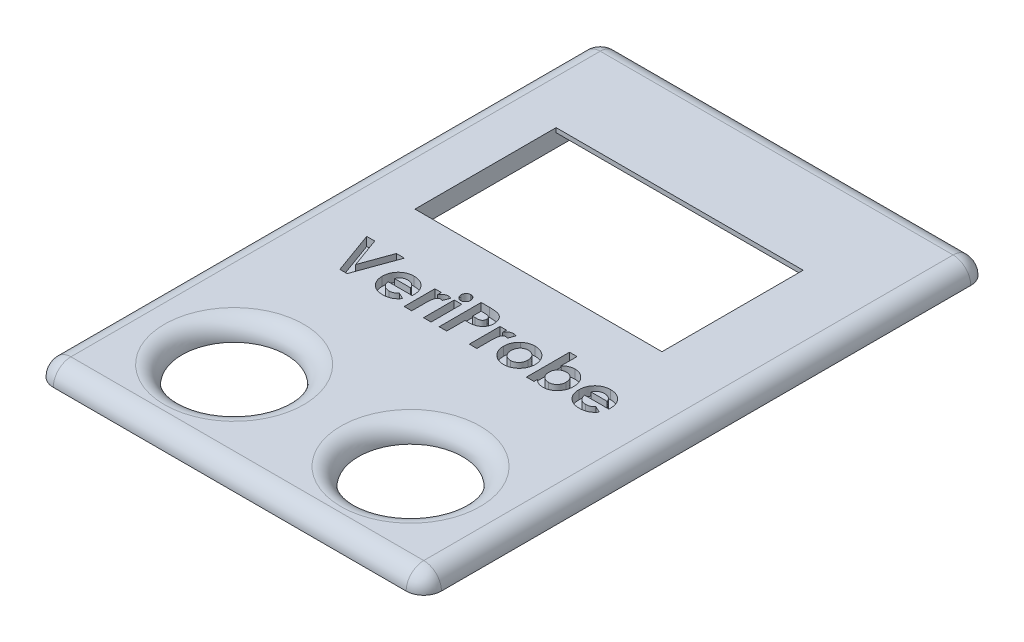
from build123d import *

# Parameters (mm, degrees)
SKETCH1_W           = 44
SKETCH1_H           = 64
BOSS_EXTRUDE1_DEPTH = 2
SKETCH2_W           = 28
SKETCH2_H           = 16
CUT_EXTRUDE1_DEPTH  = 10
SKETCH3_W           = 28
SKETCH3_H           = 7.538652277
CUT_EXTRUDE2_DEPTH  = 1.5
SKETCH4_R           = 5.9
CUT_EXTRUDE3_DEPTH  = 6.5
FILLET2_R           = 2
FILLET3_R           = 2
FILLET4_R           = 2
SKETCH5_W           = 0.854807692
SKETCH5_H           = 3.480288462
CUT_EXTRUDE4_DEPTH  = 1


with BuildPart() as part:
    # Sketch1 → Boss-Extrude1 (new body)
    with BuildSketch(Plane(origin=(0, 14, 0), x_dir=(1, 0, 0), z_dir=(0, 1, 0))):
        Rectangle(SKETCH1_W, SKETCH1_H)
    extrude(amount=BOSS_EXTRUDE1_DEPTH)

    # Sketch2 → Cut-Extrude1 (cut)
    with BuildSketch(Plane(origin=(0, 16, 0), x_dir=(1, 0, 0), z_dir=(0, 1, 0))):
        with Locations((-1, 12)):
            Rectangle(SKETCH2_W, SKETCH2_H)
    extrude(amount=-CUT_EXTRUDE1_DEPTH, mode=Mode.SUBTRACT)

    # Sketch3 → Cut-Extrude2 (cut)
    with BuildSketch(Plane.XZ.offset(-14)):
        with Locations((-1, -23.769326138)):
            Rectangle(SKETCH3_W, SKETCH3_H)
    extrude(amount=-CUT_EXTRUDE2_DEPTH, mode=Mode.SUBTRACT)

    # Sketch4 → Cut-Extrude3 (cut)
    with BuildSketch(Plane(origin=(0, 16, 0), x_dir=(1, 0, 0), z_dir=(0, 1, 0))):
        with Locations(Location((-10, -21.5, 0), (0, 0, 270))):
            Circle(SKETCH4_R)
        with Locations(Location((10, -21.5, 0), (0, 0, 270))):
            Circle(SKETCH4_R)
    extrude(amount=-CUT_EXTRUDE3_DEPTH, mode=Mode.SUBTRACT)

    # Fillet2
    fillet2_edges = [part.edges().sort_by_distance(p)[0] for p in [
        (-22, 15, -32),
        (22, 15, -32),
        (22, 15, 32),
        (-22, 15, 32),
    ]]
    fillet(fillet2_edges, radius=FILLET2_R)

    # Fillet3
    fillet3_edges = [part.edges().sort_by_distance(p)[0] for p in [
        (-21.414213562, 16, -31.414213562),
        (0, 16, -32),
        (21.414213562, 16, -31.414213562),
        (22, 16, 0),
        (21.414213562, 16, 31.414213562),
        (0, 16, 32),
        (-21.414213562, 16, 31.414213562),
        (-22, 16, 0),
    ]]
    fillet(fillet3_edges, radius=FILLET3_R - 0.0001)  # a hair under: the kernel refuses the full size

    # Fillet4
    fillet4_edges = [part.edges().sort_by_distance(p)[0] for p in [
        (-10, 16, 15.6),
        (10, 16, 15.6),
    ]]
    fillet(fillet4_edges, radius=FILLET4_R - 0.0001)  # a hair under: the kernel refuses the full size

    # Sketch5 → Cut-Extrude4 (cut)
    # profile 1 of 10: a face of its own
    with BuildSketch(Plane(origin=(0, 16, 0), x_dir=(1, 0, 0), z_dir=(0, 1, 0))):
        Polygon((-15.057266509, -1.411946768), (-14.144263204, -1.411946768), (-12.920247278, -4.794924532), (-11.693369273, -1.411946768), (-10.783228047, -1.411946768), (-12.510015908, -6.174446768), (-13.333340728, -6.174446768), align=None)
    # profile 2 of 10: a face of its own
    with BuildSketch(Plane(origin=(0, 16, 0), x_dir=(1, 0, 0), z_dir=(0, 1, 0))):
        with BuildLine():
            Line((-6.664695896, -4.64800446), (-9.40942997, -4.64800446))
            add(Edge.make_bspline(
                [(-9.40942997, -4.64800446), (-9.403833679, -4.679896713), (-9.392836526, -4.742567506), (-9.368955816, -4.833602271), (-9.338480448, -4.919391896), (-9.301957639, -5.000051063), (-9.260003163, -5.076006183), (-9.211066743, -5.146900999), (-9.155769092, -5.21267289), (-9.094429927, -5.273036006), (-9.028071661, -5.327122665), (-8.957016105, -5.374505998), (-8.881189937, -5.413357433), (-8.801462473, -5.446105161), (-8.717237966, -5.472044679), (-8.62839246, -5.489934671), (-8.535161469, -5.500502355), (-8.47164967, -5.502030849), (-8.439185079, -5.502812152)],
                knots=[0, 0, 0, 0, 1.091296461, 2.144483647, 3.168565212, 4.157007626, 5.126487748, 6.090021542, 7.05641414, 8.019231907, 8.98705074, 9.938580405, 10.892824166, 11.854447369, 12.841318655, 13.858982407, 14.905600794, 16, 16, 16, 16], degree=3))
            add(Edge.make_bspline(
                [(-8.439185079, -5.502812152), (-8.399998112, -5.501777578), (-8.322827436, -5.499740198), (-8.20977182, -5.48167166), (-8.100430571, -5.454379927), (-7.995838442, -5.413794829), (-7.894783898, -5.363273517), (-7.798930606, -5.300330179), (-7.706619422, -5.226804224), (-7.650298722, -5.170130446), (-7.621584418, -5.141236131)],
                knots=[0, 0, 0, 0, 1.021034703, 2.010718019, 2.977989445, 3.954245119, 4.929443971, 5.918328161, 6.938689359, 8, 8, 8, 8], degree=3))
            Line((-7.621584418, -5.141236131), (-6.906064586, -5.481823571))
            add(Edge.make_bspline(
                [(-6.906064586, -5.481823571), (-6.92859231, -5.512953428), (-6.973230167, -5.574636096), (-7.046099971, -5.66143954), (-7.122144252, -5.742430675), (-7.201419723, -5.81707681), (-7.284026925, -5.885165232), (-7.369736065, -5.947525382), (-7.459799747, -6.002482915), (-7.552417165, -6.052696643), (-7.649502891, -6.095744639), (-7.750788246, -6.13245445), (-7.85584423, -6.165639807), (-7.965997474, -6.190925231), (-8.080330731, -6.210940967), (-8.199117511, -6.22515479), (-8.322342156, -6.233933988), (-8.40609723, -6.234974752), (-8.448725343, -6.23550446)],
                knots=[0, 0, 0, 0, 1.028154879, 2.037251081, 3.030720504, 4.000128189, 4.949298328, 5.894184978, 6.834267904, 7.770992897, 8.712077017, 9.673380525, 10.653304757, 11.658697181, 12.695551717, 13.758623199, 14.859225354, 16, 16, 16, 16], degree=3))
            add(Edge.make_bspline(
                [(-8.448725343, -6.23550446), (-8.514307996, -6.234167427), (-8.642747841, -6.231548925), (-8.830614332, -6.207245479), (-9.009035393, -6.166947745), (-9.178514821, -6.112169165), (-9.338320013, -6.039844279), (-9.488530058, -5.951384944), (-9.630645769, -5.848487102), (-9.760324717, -5.728991202), (-9.878466065, -5.598927018), (-9.982234079, -5.459246967), (-10.069065676, -5.310926939), (-10.140373529, -5.154948548), (-10.19579647, -4.990912551), (-10.235753196, -4.818747364), (-10.260247147, -4.638535218), (-10.262892616, -4.51579063), (-10.264237663, -4.453383066)],
                knots=[0, 0, 0, 0, 1.103565453, 2.161269334, 3.182010356, 4.179077853, 5.15417608, 6.128274628, 7.109042802, 8.101804412, 9.090965879, 10.063106201, 11.02526161, 11.978650795, 12.945248442, 13.93468508, 14.949922959, 16, 16, 16, 16], degree=3))
            add(Edge.make_bspline(
                [(-10.264237663, -4.453383066), (-10.262879378, -4.389389645), (-10.260207013, -4.263485464), (-10.235964089, -4.079112137), (-10.195686004, -3.903195046), (-10.140100938, -3.735491933), (-10.069874834, -3.575478297), (-9.981938454, -3.424554063), (-9.878517559, -3.282193797), (-9.760801813, -3.149063474), (-9.630573505, -3.028898812), (-9.492193624, -2.921808084), (-9.34410733, -2.832572982), (-9.187989607, -2.760471074), (-9.02483904, -2.701890095), (-8.852769837, -2.662909345), (-8.673091181, -2.636736105), (-8.550266809, -2.634325713), (-8.487840427, -2.633100614)],
                knots=[0, 0, 0, 0, 1.079208495, 2.12329425, 3.130605359, 4.119693003, 5.099659317, 6.073216462, 7.060498243, 8.06384408, 9.066070512, 10.045757761, 11.010926815, 11.975797609, 12.942977511, 13.929384301, 14.947594487, 16, 16, 16, 16], degree=3))
            add(Edge.make_bspline(
                [(-8.487840427, -2.633100614), (-8.421943589, -2.63445839), (-8.292561939, -2.637124243), (-8.103387015, -2.661230351), (-7.923781261, -2.701773815), (-7.752979454, -2.756078735), (-7.593162805, -2.830230624), (-7.440819656, -2.916513115), (-7.299604061, -3.021635172), (-7.168010811, -3.140546297), (-7.04922101, -3.272474071), (-6.945385561, -3.415788039), (-6.857034373, -3.569089543), (-6.785424859, -3.733000251), (-6.730058828, -3.907028089), (-6.690065115, -4.090947046), (-6.665757994, -4.285456663), (-6.663161752, -4.418648546), (-6.661833817, -4.486773991)],
                knots=[0, 0, 0, 0, 1.080001299, 2.120471247, 3.119684163, 4.095710327, 5.052285597, 6.002875087, 6.961153713, 7.931888285, 8.906493152, 9.865905668, 10.82813294, 11.801621613, 12.7925306, 13.817193356, 14.883530496, 16, 16, 16, 16], degree=3))
            Line((-6.661833817, -4.486773991), (-6.664695896, -4.64800446))
        make_face()
        with BuildLine():
            add(Edge.make_bspline(
                [(-7.516641509, -3.976369845), (-7.532772253, -3.932839501), (-7.564844374, -3.846289838), (-7.637293961, -3.726872421), (-7.733432244, -3.623452089), (-7.845247965, -3.531893248), (-7.973004427, -3.457578374), (-8.112675801, -3.403771991), (-8.262496668, -3.371509009), (-8.365565351, -3.367725128), (-8.418196497, -3.365792922)],
                knots=[0, 0, 0, 0, 0.954238005, 1.897273737, 2.851915805, 3.847685534, 4.862635127, 5.880135777, 6.917509367, 8, 8, 8, 8], degree=3))
            add(Edge.make_bspline(
                [(-8.418196497, -3.365792922), (-8.475678278, -3.367649041), (-8.58804319, -3.371277369), (-8.750121926, -3.409865965), (-8.903006742, -3.467458291), (-8.993138964, -3.526837203), (-9.038313684, -3.55659821)],
                knots=[0, 0, 0, 0, 1.044195649, 2.041185066, 3.018232172, 4, 4, 4, 4], degree=3))
            add(Edge.make_bspline(
                [(-9.038313684, -3.55659821), (-9.066499336, -3.579264845), (-9.126589704, -3.627588952), (-9.204629238, -3.723990957), (-9.281498828, -3.840712144), (-9.325203428, -3.929370132), (-9.348372278, -3.976369845)],
                knots=[0, 0, 0, 0, 0.82159062, 1.751589201, 2.808063854, 4, 4, 4, 4], degree=3))
            Line((-9.348372278, -3.976369845), (-7.516641509, -3.976369845))
        make_face(mode=Mode.SUBTRACT)
    # profile 3 of 10: a face of its own
    with BuildSketch(Plane(origin=(0, 16, 0), x_dir=(1, 0, 0), z_dir=(0, 1, 0))):
        with BuildLine():
            Line((-6.051256894, -2.694158306), (-5.318564586, -2.694158306))
            Line((-5.318564586, -2.694158306), (-5.318564586, -3.122516179))
            add(Edge.make_bspline(
                [(-5.318564586, -3.122516179), (-5.297838127, -3.084447897), (-5.257327403, -3.01004186), (-5.182905807, -2.910166491), (-5.097407262, -2.826054242), (-5.003903996, -2.755945828), (-4.90211262, -2.701303204), (-4.794758925, -2.662363445), (-4.682761319, -2.637057998), (-4.606360349, -2.63442924), (-4.567745776, -2.633100614)],
                knots=[0, 0, 0, 0, 1.09866127, 2.147379032, 3.14564304, 4.131443017, 5.102343063, 6.064490016, 7.021754664, 8, 8, 8, 8], degree=3))
            add(Edge.make_bspline(
                [(-4.567745776, -2.633100614), (-4.539706777, -2.634413574), (-4.482609364, -2.637087231), (-4.395584871, -2.652629236), (-4.307304768, -2.680732137), (-4.249208853, -2.706035064), (-4.219526124, -2.718962994)],
                knots=[0, 0, 0, 0, 0.931404136, 1.896671404, 2.925354185, 4, 4, 4, 4], degree=3))
            Line((-4.219526124, -2.718962994), (-4.484745475, -3.443069063))
            add(Edge.make_bspline(
                [(-4.484745475, -3.443069063), (-4.508452298, -3.431615073), (-4.553011998, -3.41008598), (-4.617704947, -3.384679432), (-4.676416479, -3.369177599), (-4.713638513, -3.366864589), (-4.730884297, -3.365792922)],
                knots=[0, 0, 0, 0, 1.214386998, 2.282580073, 3.20428172, 4, 4, 4, 4], degree=3))
            add(Edge.make_bspline(
                [(-4.730884297, -3.365792922), (-4.747167671, -3.366503065), (-4.779199873, -3.36790004), (-4.826478507, -3.379871643), (-4.871005134, -3.400516302), (-4.914925492, -3.426964158), (-4.95477475, -3.463728657), (-4.994599394, -3.506290091), (-5.029695002, -3.558837843), (-5.066731048, -3.61732616), (-5.098265916, -3.688915807), (-5.125306094, -3.774379092), (-5.149399111, -3.874704885), (-5.165978395, -3.990425867), (-5.182002939, -4.120422237), (-5.191541141, -4.265648152), (-5.198650084, -4.425644394), (-5.199084748, -4.537327545), (-5.199311281, -4.595533006)],
                knots=[0, 0, 0, 0, 0.544232178, 1.070598461, 1.618251235, 2.182094276, 2.777567932, 3.425210017, 4.127676488, 4.886675562, 5.738955394, 6.734782583, 7.883056018, 9.186093582, 10.642914445, 12.264202625, 14.053029461, 16, 16, 16, 16], degree=3))
            Line((-5.199311281, -4.595533006), (-5.196449201, -4.765349712))
            Line((-5.196449201, -4.765349712), (-5.196449201, -6.174446768))
            Line((-5.196449201, -6.174446768), (-6.051256894, -6.174446768))
            Line((-6.051256894, -6.174446768), (-6.051256894, -2.694158306))
        make_face()
    # profile 4 of 10: a face of its own
    with BuildSketch(Plane(origin=(0, 16, 0), x_dir=(1, 0, 0), z_dir=(0, 1, 0))):
        with BuildLine():
            add(Edge.make_bspline(
                [(-3.427684177, -1.228773691), (-3.390841972, -1.230581309), (-3.318498752, -1.234130741), (-3.214857244, -1.268729809), (-3.119735345, -1.323032013), (-3.035644948, -1.39753593), (-2.965706419, -1.486507235), (-2.912270786, -1.586116526), (-2.88250402, -1.696480412), (-2.878369857, -1.77271863), (-2.876256894, -1.811683847)],
                knots=[0, 0, 0, 0, 0.989868614, 1.943702388, 2.910836514, 3.924849579, 4.949916355, 5.946401046, 6.950409252, 8, 8, 8, 8], degree=3))
            add(Edge.make_bspline(
                [(-2.876256894, -1.811683847), (-2.878294259, -1.850361912), (-2.882264162, -1.925727962), (-2.912955886, -2.034593608), (-2.964246799, -2.134154518), (-3.034751786, -2.221804434), (-3.117930533, -2.295108422), (-3.210973946, -2.350396449), (-3.313622267, -2.383070779), (-3.384842939, -2.386916924), (-3.421005992, -2.388869845)],
                knots=[0, 0, 0, 0, 1.05296456, 2.051751585, 3.055639087, 4.085634717, 5.099016424, 6.062201612, 7.016062274, 8, 8, 8, 8], degree=3))
            add(Edge.make_bspline(
                [(-3.421005992, -2.388869845), (-3.4581698, -2.387068688), (-3.531142403, -2.383532047), (-3.635633984, -2.348852025), (-3.732024566, -2.294977487), (-3.815750179, -2.218951339), (-3.88648966, -2.129347826), (-3.937591204, -2.027419544), (-3.969556484, -1.916300992), (-3.973350735, -1.838933634), (-3.975295355, -1.799281503)],
                knots=[0, 0, 0, 0, 0.989065327, 1.942068821, 2.907541208, 3.917690034, 4.939857478, 5.938239964, 6.943311734, 8, 8, 8, 8], degree=3))
            add(Edge.make_bspline(
                [(-3.975295355, -1.799281503), (-3.973179077, -1.761260215), (-3.969021953, -1.686572884), (-3.939076882, -1.57866271), (-3.886866526, -1.480728007), (-3.817431771, -1.393385406), (-3.734079971, -1.320271266), (-3.639015175, -1.267618256), (-3.536071178, -1.234448228), (-3.464186227, -1.230684734), (-3.427684177, -1.228773691)],
                knots=[0, 0, 0, 0, 1.038616768, 2.040212704, 3.031499824, 4.052181184, 5.074969369, 6.039807101, 7.004644834, 8, 8, 8, 8], degree=3))
        make_face()
    # profile 5 of 10: a face of its own
    with BuildSketch(Plane(origin=(0, 16, 0), x_dir=(1, 0, 0), z_dir=(0, 1, 0))):
        with Locations((-3.425776124, -4.434302537)):
            Rectangle(SKETCH5_W, SKETCH5_H)
    # profile 6 of 10: a face of its own
    with BuildSketch(Plane(origin=(0, 16, 0), x_dir=(1, 0, 0), z_dir=(0, 1, 0))):
        with BuildLine():
            Line((-2.082506894, -1.411946768), (-1.128480451, -1.411946768))
            add(Edge.make_bspline(
                [(-1.128480451, -1.411946768), (-1.066145601, -1.412225792), (-0.945888609, -1.412764088), (-0.772468133, -1.419291641), (-0.612479252, -1.430989415), (-0.465958724, -1.445446014), (-0.332966795, -1.465713603), (-0.213336919, -1.488948806), (-0.107044269, -1.517256047), (-0.012890239, -1.550856349), (0.071609962, -1.590469792), (0.151574406, -1.632660937), (0.225195888, -1.68301458), (0.296190306, -1.73610382), (0.360498787, -1.797000252), (0.422133279, -1.861651128), (0.478483393, -1.932620451), (0.529810235, -2.009049156), (0.57637159, -2.089525166), (0.617050704, -2.174192349), (0.650047323, -2.263184683), (0.677727384, -2.355926487), (0.699960278, -2.45241372), (0.7147592, -2.553239788), (0.724811373, -2.657700683), (0.725698338, -2.728796834), (0.726146953, -2.764756263)],
                knots=[0, 0, 0, 0, 1.698747864, 3.27724071, 4.728299578, 6.070144658, 7.288476769, 8.393259625, 9.389771311, 10.283485332, 11.113357557, 11.931608583, 12.74405601, 13.541433047, 14.344816069, 15.154114104, 15.974336324, 16.810834471, 17.661136416, 18.50621059, 19.367396281, 20.244825668, 21.142564693, 22.063065223, 23.020325768, 24, 24, 24, 24], degree=3))
            add(Edge.make_bspline(
                [(0.726146953, -2.764756263), (0.725497864, -2.804537322), (0.724222324, -2.882711993), (0.711717922, -2.997306468), (0.690356454, -3.106561926), (0.662438132, -3.211399736), (0.623508018, -3.310095084), (0.579032191, -3.405002871), (0.524312816, -3.493462175), (0.461787182, -3.576579515), (0.393502057, -3.655030673), (0.317836355, -3.726550522), (0.236232296, -3.791626609), (0.149162257, -3.850940936), (0.056299351, -3.904373855), (-0.042289417, -3.952425707), (-0.147277267, -3.993559644), (-0.220387647, -4.015072361), (-0.257454309, -4.02597922)],
                knots=[0, 0, 0, 0, 1.102006807, 2.165578795, 3.188629044, 4.184801286, 5.166646146, 6.124351954, 7.085497154, 8.042432466, 9.003981491, 9.963833307, 10.922997304, 11.89326795, 12.880200226, 13.889073926, 14.929769137, 16, 16, 16, 16], degree=3))
            add(Edge.make_bspline(
                [(-0.257454309, -4.02597922), (-0.281868546, -4.032053521), (-0.334757643, -4.045212414), (-0.422274573, -4.058571993), (-0.523128646, -4.070855305), (-0.637645989, -4.081411325), (-0.765892624, -4.088586958), (-0.907744375, -4.094190809), (-1.063265527, -4.098265387), (-1.171408786, -4.098409971), (-1.227699201, -4.098485229)],
                knots=[0, 0, 0, 0, 0.618981996, 1.340914327, 2.176866532, 3.120127938, 4.170906482, 5.338178032, 6.614476169, 8, 8, 8, 8], degree=3))
            Line((-1.227699201, -4.098485229), (-1.227699201, -6.174446768))
            Line((-1.227699201, -6.174446768), (-2.082506894, -6.174446768))
            Line((-2.082506894, -6.174446768), (-2.082506894, -1.411946768))
        make_face()
        with BuildLine():
            Line((-1.227699201, -3.243677537), (-0.925272819, -3.243677537))
            add(Edge.make_bspline(
                [(-0.925272819, -3.243677537), (-0.870241564, -3.243328596), (-0.768983238, -3.24268654), (-0.630700121, -3.233402031), (-0.519573149, -3.219222711), (-0.431780777, -3.198886287), (-0.362460384, -3.168023071), (-0.302675885, -3.132320142), (-0.251397194, -3.087174768), (-0.206997395, -3.035588454), (-0.171501094, -2.976313193), (-0.146886258, -2.910314169), (-0.130896945, -2.838978091), (-0.129420183, -2.789332902), (-0.12866074, -2.763802236)],
                knots=[0, 0, 0, 0, 1.8619151, 3.425951444, 4.686033666, 5.651700536, 6.461346321, 7.243864085, 7.999046032, 8.762387399, 9.539336099, 10.322741239, 11.137448474, 12, 12, 12, 12], degree=3))
            add(Edge.make_bspline(
                [(-0.12866074, -2.763802236), (-0.129412371, -2.741496426), (-0.130870717, -2.698217791), (-0.141584121, -2.635755985), (-0.158658206, -2.577528697), (-0.183397898, -2.524144034), (-0.215380463, -2.475692703), (-0.254373681, -2.432193793), (-0.299877193, -2.392715738), (-0.335008565, -2.3718194), (-0.352856954, -2.361203078)],
                knots=[0, 0, 0, 0, 1.102301479, 2.1387299, 3.123554645, 4.094223062, 5.036071848, 5.982632524, 6.975082478, 8, 8, 8, 8], degree=3))
            add(Edge.make_bspline(
                [(-0.352856954, -2.361203078), (-0.367975569, -2.35355716), (-0.399984776, -2.337369187), (-0.454499559, -2.318549483), (-0.517408786, -2.302672991), (-0.589137165, -2.289495655), (-0.669398551, -2.279268674), (-0.758178625, -2.271447592), (-0.855608034, -2.26830243), (-0.923364358, -2.267284682), (-0.958663744, -2.26675446)],
                knots=[0, 0, 0, 0, 0.656809284, 1.390599849, 2.23162475, 3.173112763, 4.218524733, 5.370385145, 6.63003504, 8, 8, 8, 8], degree=3))
            Line((-0.958663744, -2.26675446), (-1.227699201, -2.26675446))
            Line((-1.227699201, -2.26675446), (-1.227699201, -3.243677537))
        make_face(mode=Mode.SUBTRACT)
    # profile 7 of 10: a face of its own
    with BuildSketch(Plane(origin=(0, 16, 0), x_dir=(1, 0, 0), z_dir=(0, 1, 0))):
        with BuildLine():
            Line((1.336723876, -2.694158306), (2.069416183, -2.694158306))
            Line((2.069416183, -2.694158306), (2.069416183, -3.122516179))
            add(Edge.make_bspline(
                [(2.069416183, -3.122516179), (2.090142642, -3.084447897), (2.130653366, -3.01004186), (2.205074963, -2.910166491), (2.290573507, -2.826054242), (2.384076773, -2.755945828), (2.485868149, -2.701303204), (2.593221845, -2.662363445), (2.70521945, -2.637057998), (2.78162042, -2.63442924), (2.820234993, -2.633100614)],
                knots=[0, 0, 0, 0, 1.09866127, 2.147379032, 3.14564304, 4.131443017, 5.102343063, 6.064490016, 7.021754664, 8, 8, 8, 8], degree=3))
            add(Edge.make_bspline(
                [(2.820234993, -2.633100614), (2.848273992, -2.634413574), (2.905371405, -2.637087231), (2.992395898, -2.652629236), (3.080676001, -2.680732137), (3.138771916, -2.706035064), (3.168454645, -2.718962994)],
                knots=[0, 0, 0, 0, 0.931404136, 1.896671404, 2.925354185, 4, 4, 4, 4], degree=3))
            Line((3.168454645, -2.718962994), (2.903235294, -3.443069063))
            add(Edge.make_bspline(
                [(2.903235294, -3.443069063), (2.879528471, -3.431615073), (2.834968771, -3.41008598), (2.770275823, -3.384679432), (2.71156429, -3.369177599), (2.674342256, -3.366864589), (2.657096472, -3.365792922)],
                knots=[0, 0, 0, 0, 1.214386998, 2.282580073, 3.20428172, 4, 4, 4, 4], degree=3))
            add(Edge.make_bspline(
                [(2.657096472, -3.365792922), (2.640813098, -3.366503065), (2.608780896, -3.36790004), (2.561502263, -3.379871643), (2.516975635, -3.400516302), (2.473055278, -3.426964158), (2.43320602, -3.463728657), (2.393381376, -3.506290091), (2.358285767, -3.558837843), (2.321249722, -3.61732616), (2.289714853, -3.688915807), (2.262674675, -3.774379092), (2.238581659, -3.874704885), (2.222002374, -3.990425867), (2.20597783, -4.120422237), (2.196439628, -4.265648152), (2.189330685, -4.425644394), (2.188896021, -4.537327545), (2.188669489, -4.595533006)],
                knots=[0, 0, 0, 0, 0.544232178, 1.070598461, 1.618251235, 2.182094276, 2.777567932, 3.425210017, 4.127676488, 4.886675562, 5.738955394, 6.734782583, 7.883056018, 9.186093582, 10.642914445, 12.264202625, 14.053029461, 16, 16, 16, 16], degree=3))
            Line((2.188669489, -4.595533006), (2.191531568, -4.765349712))
            Line((2.191531568, -4.765349712), (2.191531568, -6.174446768))
            Line((2.191531568, -6.174446768), (1.336723876, -6.174446768))
            Line((1.336723876, -6.174446768), (1.336723876, -2.694158306))
        make_face()
    # profile 8 of 10: a face of its own
    with BuildSketch(Plane(origin=(0, 16, 0), x_dir=(1, 0, 0), z_dir=(0, 1, 0))):
        with BuildLine():
            add(Edge.make_bspline(
                [(5.253956448, -2.633100614), (5.294370105, -2.633819803), (5.374407459, -2.635244122), (5.4936131, -2.647100281), (5.610734751, -2.666444093), (5.726445612, -2.691490954), (5.839671199, -2.726585351), (5.951005368, -2.768675655), (6.061443587, -2.817000245), (6.168244802, -2.874523411), (6.272180571, -2.93691253), (6.370717866, -3.005732847), (6.463038402, -3.080443803), (6.550855963, -3.159313165), (6.630078109, -3.245774646), (6.705767559, -3.335662172), (6.773834997, -3.432196098), (6.83685564, -3.533024115), (6.892962465, -3.637563155), (6.941680924, -3.745086007), (6.983963966, -3.854106092), (7.017070741, -3.965951348), (7.044480099, -4.079146948), (7.061777351, -4.195080019), (7.074074499, -4.312559637), (7.075453399, -4.391656584), (7.076146953, -4.431440458)],
                knots=[0, 0, 0, 0, 1.022364134, 2.024744242, 3.027414945, 4.024939316, 5.017584196, 6.023349371, 7.035562955, 8.064994934, 9.090267829, 10.101425541, 11.102933353, 12.093946398, 13.084502048, 14.067315274, 15.065326281, 16.070028806, 17.074376865, 18.064572984, 19.055292013, 20.030201733, 21.013838017, 21.999348303, 22.993720005, 24, 24, 24, 24], degree=3))
            add(Edge.make_bspline(
                [(7.076146953, -4.431440458), (7.075415022, -4.471535143), (7.073959777, -4.551252467), (7.062222247, -4.669837126), (7.042804393, -4.786315376), (7.017661402, -4.90137341), (6.982698337, -5.013538952), (6.941847728, -5.124465364), (6.891701999, -5.23264068), (6.8362622, -5.339244988), (6.772836361, -5.441141251), (6.704827842, -5.538642214), (6.629455417, -5.629189968), (6.550867467, -5.715592652), (6.465336387, -5.794928513), (6.374227415, -5.868485755), (6.2783293, -5.937163647), (6.176952434, -5.999350876), (6.071395286, -6.053992577), (5.963438056, -6.10325653), (5.852449471, -6.144272288), (5.738659228, -6.177719509), (5.621998316, -6.203616855), (5.502724294, -6.221209231), (5.381094033, -6.233444525), (5.299144352, -6.234813394), (5.257772554, -6.23550446)],
                knots=[0, 0, 0, 0, 1.012026251, 2.012137606, 3.004615893, 3.992048833, 4.982446996, 5.968083444, 6.973977695, 7.990229942, 8.999482246, 10.001782172, 10.988562221, 11.971415814, 12.948383116, 13.930088534, 14.925840678, 15.924049238, 16.929462851, 17.924729459, 18.917889337, 19.913673841, 20.916777188, 21.931792057, 22.95587778, 24, 24, 24, 24], degree=3))
            add(Edge.make_bspline(
                [(5.257772554, -6.23550446), (5.197278548, -6.233728842), (5.078043941, -6.230229071), (4.902439556, -6.206256556), (4.733741709, -6.164993574), (4.571675511, -6.107473886), (4.416030433, -6.033764549), (4.26816482, -5.942538052), (4.126607813, -5.835590382), (3.993811286, -5.713825471), (3.872151678, -5.580238337), (3.765867372, -5.437634886), (3.675623396, -5.288152503), (3.601500941, -5.131620729), (3.544293521, -4.967824915), (3.502980003, -4.797254754), (3.478978179, -4.619430799), (3.475508008, -4.498612074), (3.473743106, -4.437164616)],
                knots=[0, 0, 0, 0, 1.029999031, 2.030143771, 3.011211297, 3.982305373, 4.953580601, 5.938004764, 6.935448627, 7.970290061, 9.001484052, 10.007591832, 10.993831261, 11.969999897, 12.951306496, 13.942897864, 14.953773953, 16, 16, 16, 16], degree=3))
            add(Edge.make_bspline(
                [(3.473743106, -4.437164616), (3.475569556, -4.371552201), (3.479159405, -4.242592313), (3.507664389, -4.053663138), (3.553183774, -3.872772407), (3.618523984, -3.700426128), (3.701990355, -3.536306432), (3.803883878, -3.380759466), (3.924708117, -3.233749996), (4.01723529, -3.144833629), (4.064285474, -3.099619544)],
                knots=[0, 0, 0, 0, 1.043912699, 2.05178951, 3.033892, 4.007821512, 4.978932272, 5.95884105, 6.962068106, 8, 8, 8, 8], degree=3))
            add(Edge.make_bspline(
                [(4.064285474, -3.099619544), (4.107458721, -3.062142154), (4.192630599, -2.988207021), (4.33100687, -2.894432426), (4.472688556, -2.813439785), (4.619373774, -2.74684877), (4.771471445, -2.696640219), (4.928202154, -2.660092886), (5.089533311, -2.637644444), (5.198870209, -2.634622921), (5.253956448, -2.633100614)],
                knots=[0, 0, 0, 0, 1.048115528, 2.067714963, 3.060638214, 4.039924844, 5.017819947, 5.994373833, 6.98952318, 8, 8, 8, 8], degree=3))
        make_face()
        with BuildLine():
            add(Edge.make_bspline(
                [(5.273036977, -3.426850614), (5.239941169, -3.427950609), (5.174791714, -3.430115961), (5.078890006, -3.441736827), (4.98818516, -3.465554791), (4.900875609, -3.495844722), (4.818505868, -3.536353236), (4.738820124, -3.583757534), (4.665961859, -3.643078179), (4.596405229, -3.708148587), (4.533263313, -3.780407528), (4.479460405, -3.859133591), (4.431386314, -3.941314881), (4.39493417, -4.029960157), (4.364766535, -4.122646487), (4.344349442, -4.220871401), (4.33014057, -4.323537671), (4.329085763, -4.39386477), (4.328550799, -4.429532405)],
                knots=[0, 0, 0, 0, 1.030650113, 2.02884584, 2.99876339, 3.944280128, 4.900564847, 5.851248946, 6.823638398, 7.81794922, 8.81432732, 9.802856497, 10.78262424, 11.771747962, 12.779760563, 13.812642396, 14.89064281, 16, 16, 16, 16], degree=3))
            add(Edge.make_bspline(
                [(4.328550799, -4.429532405), (4.32917678, -4.46645786), (4.330400139, -4.538621572), (4.343068283, -4.643990294), (4.36395847, -4.743984514), (4.393636878, -4.838449761), (4.430962488, -4.928064095), (4.476756683, -5.012324719), (4.53150277, -5.090725007), (4.593571544, -5.163168414), (4.661534202, -5.228926097), (4.736002368, -5.285356879), (4.813857597, -5.334387739), (4.896894097, -5.373767088), (4.98393251, -5.40417114), (5.075231218, -5.426556621), (5.171269995, -5.438616833), (5.236753264, -5.440694203), (5.270174897, -5.44175446)],
                knots=[0, 0, 0, 0, 1.141730614, 2.231293227, 3.276944405, 4.297399982, 5.28939179, 6.275415646, 7.257752684, 8.24146775, 9.222424823, 10.176631434, 11.126518621, 12.063689483, 13.012557477, 13.974037417, 14.965980454, 16, 16, 16, 16], degree=3))
            add(Edge.make_bspline(
                [(5.270174897, -5.44175446), (5.303613247, -5.44081406), (5.369171824, -5.43897033), (5.465323381, -5.425163702), (5.557088327, -5.403434792), (5.644870116, -5.372769063), (5.727959024, -5.33254682), (5.806673123, -5.28328139), (5.881704871, -5.226065706), (5.950579594, -5.159067301), (6.014335607, -5.086397969), (6.070245818, -5.007583811), (6.116966498, -4.923323165), (6.155285822, -4.8341462), (6.18502241, -4.740175488), (6.205566756, -4.641061753), (6.219783224, -4.537112154), (6.220814176, -4.465835192), (6.22133926, -4.429532405)],
                knots=[0, 0, 0, 0, 1.031504075, 2.022346795, 2.991027682, 3.937587355, 4.885570121, 5.833146507, 6.798790848, 7.791235734, 8.792807298, 9.778388351, 10.766749885, 11.760164525, 12.768777521, 13.802286646, 14.880660483, 16, 16, 16, 16], degree=3))
            add(Edge.make_bspline(
                [(6.22133926, -4.429532405), (6.220705316, -4.393242305), (6.219461312, -4.322029358), (6.206792265, -4.217939169), (6.186107089, -4.119145797), (6.156045894, -4.026071081), (6.118942143, -3.937653186), (6.073116295, -3.85434469), (6.018100218, -3.776555909), (5.95572971, -3.704672563), (5.88674825, -3.63983761), (5.813573031, -3.582020572), (5.734530759, -3.534201439), (5.651104316, -3.494781403), (5.563071744, -3.464453313), (5.470531873, -3.441940968), (5.373201098, -3.430052367), (5.306773962, -3.427929019), (5.273036977, -3.426850614)],
                knots=[0, 0, 0, 0, 1.123894411, 2.205445421, 3.243160173, 4.246488011, 5.231014757, 6.210004299, 7.185865357, 8.177612767, 9.153374344, 10.115157457, 11.061423229, 12.009021698, 12.96873347, 13.94135618, 14.954456845, 16, 16, 16, 16], degree=3))
        make_face(mode=Mode.SUBTRACT)
    # profile 9 of 10: a face of its own
    with BuildSketch(Plane(origin=(0, 16, 0), x_dir=(1, 0, 0), z_dir=(0, 1, 0))):
        with BuildLine():
            Line((8.663646953, -1.289831383), (8.663646953, -3.099619544))
            add(Edge.make_bspline(
                [(8.663646953, -3.099619544), (8.703340312, -3.062245853), (8.781260491, -2.988879309), (8.908482273, -2.894008336), (9.040268885, -2.813938013), (9.176502268, -2.746762758), (9.318408533, -2.697089553), (9.464244106, -2.658491612), (9.615503322, -2.638049329), (9.717793538, -2.634759298), (9.769363599, -2.633100614)],
                knots=[0, 0, 0, 0, 1.061187343, 2.083167259, 3.083809127, 4.061667593, 5.035358583, 6.007314429, 6.995378812, 8, 8, 8, 8], degree=3))
            add(Edge.make_bspline(
                [(9.769363599, -2.633100614), (9.825420955, -2.634443329), (9.935835758, -2.637088042), (10.098290131, -2.661780236), (10.253973314, -2.701693468), (10.403478967, -2.757423219), (10.546010543, -2.829778994), (10.683169484, -2.916411372), (10.812590322, -3.02089528), (10.934335975, -3.139240827), (11.046953737, -3.268956336), (11.144910449, -3.409984626), (11.226504589, -3.560469492), (11.295659632, -3.71863189), (11.34613176, -3.887094889), (11.385031465, -4.063598673), (11.406708563, -4.249636501), (11.409712, -4.376372577), (11.411243106, -4.440980722)],
                knots=[0, 0, 0, 0, 0.985987466, 1.942075377, 2.884088208, 3.810275091, 4.743821533, 5.692411115, 6.659945104, 7.665215984, 8.677116751, 9.678438675, 10.680260931, 11.685531812, 12.710472044, 13.769734641, 14.863044265, 16, 16, 16, 16], degree=3))
            add(Edge.make_bspline(
                [(11.411243106, -4.440980722), (11.409794016, -4.503377158), (11.406937539, -4.626374292), (11.383859006, -4.806944205), (11.344742825, -4.979439661), (11.289870751, -5.143922781), (11.220113561, -5.300913362), (11.134970096, -5.450303227), (11.033943696, -5.591570562), (10.918444449, -5.722812352), (10.792244739, -5.84166155), (10.660753686, -5.94829291), (10.521352422, -6.035668947), (10.377525666, -6.109464705), (10.227007602, -6.165894893), (10.070826335, -6.205430582), (9.909229218, -6.231862643), (9.799362861, -6.23427843), (9.743604885, -6.23550446)],
                knots=[0, 0, 0, 0, 1.098553145, 2.165490463, 3.199345634, 4.208780719, 5.21409072, 6.219899742, 7.23156933, 8.267303578, 9.293302409, 10.281606823, 11.243293419, 12.184993323, 13.124258899, 14.066907486, 15.018941492, 16, 16, 16, 16], degree=3))
            add(Edge.make_bspline(
                [(9.743604885, -6.23550446), (9.693937068, -6.234176708), (9.596137526, -6.231562268), (9.451976929, -6.212171569), (9.31344383, -6.179560151), (9.178788226, -6.134637711), (9.047644752, -6.07326045), (8.917729542, -5.996516215), (8.78820649, -5.903434014), (8.706002581, -5.831703465), (8.663646953, -5.794744244)],
                knots=[0, 0, 0, 0, 0.996418773, 1.962021009, 2.912343664, 3.848616743, 4.805003894, 5.811808768, 6.872532775, 8, 8, 8, 8], degree=3))
            Line((8.663646953, -5.794744244), (8.663646953, -6.174446768))
            Line((8.663646953, -6.174446768), (7.80883926, -6.174446768))
            Line((7.80883926, -6.174446768), (7.80883926, -1.289831383))
            Line((7.80883926, -1.289831383), (8.663646953, -1.289831383))
        make_face()
        with BuildLine():
            add(Edge.make_bspline(
                [(9.584282469, -3.426850614), (9.549591823, -3.427917375), (9.481579298, -3.430008807), (9.381724523, -3.441994794), (9.287110366, -3.464546516), (9.196298296, -3.493775857), (9.110438253, -3.533230877), (9.028827805, -3.581058471), (8.952165955, -3.638089227), (8.880054827, -3.702064795), (8.815257247, -3.774037431), (8.757690217, -3.850943924), (8.709930698, -3.933785744), (8.670117933, -4.021512465), (8.640080942, -4.115073281), (8.617802196, -4.21367227), (8.60569511, -4.317611593), (8.603640918, -4.388480478), (8.60258926, -4.424762272)],
                knots=[0, 0, 0, 0, 1.060469436, 2.079096586, 3.066888298, 4.028858836, 4.99004353, 5.948472697, 6.914558426, 7.905691313, 8.889602648, 9.869280844, 10.836099585, 11.806137001, 12.808075328, 13.83377171, 14.890985086, 16, 16, 16, 16], degree=3))
            add(Edge.make_bspline(
                [(8.60258926, -4.424762272), (8.603654151, -4.461679028), (8.605744044, -4.534129751), (8.617750202, -4.640285441), (8.639872573, -4.740859823), (8.670542201, -4.836080925), (8.709677498, -4.925961101), (8.757380431, -5.010833551), (8.815581124, -5.088837489), (8.87966688, -5.162707732), (8.952223888, -5.227539307), (9.028540375, -5.285684312), (9.110418425, -5.333583199), (9.196688797, -5.37239262), (9.286696876, -5.404643036), (9.381783956, -5.426434608), (9.481563527, -5.438642881), (9.549586496, -5.440703444), (9.584282469, -5.44175446)],
                knots=[0, 0, 0, 0, 1.117193555, 2.192540452, 3.22680955, 4.227918444, 5.21468246, 6.188555072, 7.166222992, 8.154674427, 9.142376254, 10.104580718, 11.053462639, 12.005072638, 12.963662044, 13.941614018, 14.950094269, 16, 16, 16, 16], degree=3))
            add(Edge.make_bspline(
                [(9.584282469, -5.44175446), (9.617716387, -5.440778098), (9.683896366, -5.438845462), (9.780728887, -5.425360203), (9.873809064, -5.403323951), (9.962407956, -5.37191432), (10.0470649, -5.331019012), (10.128550587, -5.283164733), (10.204051827, -5.223374384), (10.276530657, -5.157659686), (10.341379847, -5.083552407), (10.399557364, -5.004823184), (10.448428207, -4.920769341), (10.487230505, -4.831112146), (10.519309471, -4.737549833), (10.541210793, -4.638369892), (10.553260499, -4.534457571), (10.555366595, -4.463589219), (10.556435414, -4.427624352)],
                knots=[0, 0, 0, 0, 1.021711385, 2.02240246, 2.981887075, 3.941027022, 4.888772411, 5.852236371, 6.822344989, 7.82661704, 8.838806642, 9.826383926, 10.814965113, 11.80282933, 12.807900643, 13.833672313, 14.900613836, 16, 16, 16, 16], degree=3))
            add(Edge.make_bspline(
                [(10.556435414, -4.427624352), (10.555349526, -4.391983048), (10.553210023, -4.3217597), (10.541407069, -4.218712691), (10.518662513, -4.120974655), (10.489944616, -4.027747143), (10.44982314, -3.940243734), (10.402383539, -3.857429277), (10.346562059, -3.779053719), (10.281806738, -3.707232818), (10.210781564, -3.641880958), (10.1349634, -3.584076698), (10.054649991, -3.534868804), (9.968747645, -3.496062805), (9.879283521, -3.464133831), (9.784890421, -3.442140732), (9.686048231, -3.429968521), (9.618659991, -3.427903875), (9.584282469, -3.426850614)],
                knots=[0, 0, 0, 0, 1.094680664, 2.156827393, 3.177782763, 4.17210342, 5.146667393, 6.126451192, 7.099203661, 8.094961544, 9.09004898, 10.058676268, 11.018205477, 11.974998356, 12.947750825, 13.930643515, 14.944335875, 16, 16, 16, 16], degree=3))
        make_face(mode=Mode.SUBTRACT)
    # profile 10 of 10: a face of its own
    with BuildSketch(Plane(origin=(0, 16, 0), x_dir=(1, 0, 0), z_dir=(0, 1, 0))):
        with BuildLine():
            Line((15.621361796, -4.64800446), (12.876627722, -4.64800446))
            add(Edge.make_bspline(
                [(12.876627722, -4.64800446), (12.882224013, -4.679896713), (12.893221167, -4.742567506), (12.917101877, -4.833602271), (12.947577244, -4.919391896), (12.984100053, -5.000051063), (13.026054529, -5.076006183), (13.074990949, -5.146900999), (13.1302886, -5.21267289), (13.191627765, -5.273036006), (13.257986032, -5.327122665), (13.329041587, -5.374505998), (13.404867756, -5.413357433), (13.48459522, -5.446105161), (13.568819726, -5.472044679), (13.657665233, -5.489934671), (13.750896223, -5.500502355), (13.814408022, -5.502030849), (13.846872614, -5.502812152)],
                knots=[0, 0, 0, 0, 1.091296461, 2.144483647, 3.168565212, 4.157007626, 5.126487748, 6.090021542, 7.05641414, 8.019231907, 8.98705074, 9.938580405, 10.892824166, 11.854447369, 12.841318655, 13.858982407, 14.905600794, 16, 16, 16, 16], degree=3))
            add(Edge.make_bspline(
                [(13.846872614, -5.502812152), (13.88605958, -5.501777578), (13.963230256, -5.499740198), (14.076285872, -5.48167166), (14.185627122, -5.454379927), (14.29021925, -5.413794829), (14.391273794, -5.363273517), (14.487127086, -5.300330179), (14.57943827, -5.226804224), (14.63575897, -5.170130446), (14.664473275, -5.141236131)],
                knots=[0, 0, 0, 0, 1.021034703, 2.010718019, 2.977989445, 3.954245119, 4.929443971, 5.918328161, 6.938689359, 8, 8, 8, 8], degree=3))
            Line((14.664473275, -5.141236131), (15.379993106, -5.481823571))
            add(Edge.make_bspline(
                [(15.379993106, -5.481823571), (15.357465382, -5.512953428), (15.312827525, -5.574636096), (15.239957721, -5.66143954), (15.16391344, -5.742430675), (15.08463797, -5.81707681), (15.002030768, -5.885165232), (14.916321627, -5.947525382), (14.826257945, -6.002482915), (14.733640528, -6.052696643), (14.636554802, -6.095744639), (14.535269447, -6.13245445), (14.430213462, -6.165639807), (14.320060219, -6.190925231), (14.205726961, -6.210940967), (14.086940182, -6.22515479), (13.963715536, -6.233933988), (13.879960463, -6.234974752), (13.837332349, -6.23550446)],
                knots=[0, 0, 0, 0, 1.028154879, 2.037251081, 3.030720504, 4.000128189, 4.949298328, 5.894184978, 6.834267904, 7.770992897, 8.712077017, 9.673380525, 10.653304757, 11.658697181, 12.695551717, 13.758623199, 14.859225354, 16, 16, 16, 16], degree=3))
            add(Edge.make_bspline(
                [(13.837332349, -6.23550446), (13.771749697, -6.234167427), (13.643309852, -6.231548925), (13.45544336, -6.207245479), (13.2770223, -6.166947745), (13.107542872, -6.112169165), (12.947737679, -6.039844279), (12.797527634, -5.951384944), (12.655411923, -5.848487102), (12.525732975, -5.728991202), (12.407591627, -5.598927018), (12.303823613, -5.459246967), (12.216992017, -5.310926939), (12.145684163, -5.154948548), (12.090261222, -4.990912551), (12.050304497, -4.818747364), (12.025810545, -4.638535218), (12.023165077, -4.51579063), (12.02182003, -4.453383066)],
                knots=[0, 0, 0, 0, 1.103565453, 2.161269334, 3.182010356, 4.179077853, 5.15417608, 6.128274628, 7.109042802, 8.101804412, 9.090965879, 10.063106201, 11.02526161, 11.978650795, 12.945248442, 13.93468508, 14.949922959, 16, 16, 16, 16], degree=3))
            add(Edge.make_bspline(
                [(12.02182003, -4.453383066), (12.023178315, -4.389389645), (12.02585068, -4.263485464), (12.050093604, -4.079112137), (12.090371689, -3.903195046), (12.145956754, -3.735491933), (12.216182859, -3.575478297), (12.304119238, -3.424554063), (12.407540133, -3.282193797), (12.525255879, -3.149063474), (12.655484187, -3.028898812), (12.793864068, -2.921808084), (12.941950362, -2.832572982), (13.098068085, -2.760471074), (13.261218652, -2.701890095), (13.433287855, -2.662909345), (13.612966511, -2.636736105), (13.735790883, -2.634325713), (13.798217265, -2.633100614)],
                knots=[0, 0, 0, 0, 1.079208495, 2.12329425, 3.130605359, 4.119693003, 5.099659317, 6.073216462, 7.060498243, 8.06384408, 9.066070512, 10.045757761, 11.010926815, 11.975797609, 12.942977511, 13.929384301, 14.947594487, 16, 16, 16, 16], degree=3))
            add(Edge.make_bspline(
                [(13.798217265, -2.633100614), (13.864114103, -2.63445839), (13.993495753, -2.637124243), (14.182670677, -2.661230351), (14.362276432, -2.701773815), (14.533078238, -2.756078735), (14.692894888, -2.830230624), (14.845238036, -2.916513115), (14.986453631, -3.021635172), (15.118046881, -3.140546297), (15.236836683, -3.272474071), (15.340672132, -3.415788039), (15.429023319, -3.569089543), (15.500632833, -3.733000251), (15.555998865, -3.907028089), (15.595992577, -4.090947046), (15.620299699, -4.285456663), (15.622895941, -4.418648546), (15.624223876, -4.486773991)],
                knots=[0, 0, 0, 0, 1.080001299, 2.120471247, 3.119684163, 4.095710327, 5.052285597, 6.002875087, 6.961153713, 7.931888285, 8.906493152, 9.865905668, 10.82813294, 11.801621613, 12.7925306, 13.817193356, 14.883530496, 16, 16, 16, 16], degree=3))
            Line((15.624223876, -4.486773991), (15.621361796, -4.64800446))
        make_face()
        with BuildLine():
            add(Edge.make_bspline(
                [(14.769416183, -3.976369845), (14.753285439, -3.932839501), (14.721213318, -3.846289838), (14.648763732, -3.726872421), (14.552625448, -3.623452089), (14.440809727, -3.531893248), (14.313053265, -3.457578374), (14.173381891, -3.403771991), (14.023561024, -3.371509009), (13.920492342, -3.367725128), (13.867861195, -3.365792922)],
                knots=[0, 0, 0, 0, 0.954238005, 1.897273737, 2.851915805, 3.847685534, 4.862635127, 5.880135777, 6.917509367, 8, 8, 8, 8], degree=3))
            add(Edge.make_bspline(
                [(13.867861195, -3.365792922), (13.810379415, -3.367649041), (13.698014502, -3.371277369), (13.535935766, -3.409865965), (13.383050951, -3.467458291), (13.292918728, -3.526837203), (13.247744008, -3.55659821)],
                knots=[0, 0, 0, 0, 1.044195649, 2.041185066, 3.018232172, 4, 4, 4, 4], degree=3))
            add(Edge.make_bspline(
                [(13.247744008, -3.55659821), (13.219558357, -3.579264845), (13.159467989, -3.627588952), (13.081428455, -3.723990957), (13.004558864, -3.840712144), (12.960854264, -3.929370132), (12.937685414, -3.976369845)],
                knots=[0, 0, 0, 0, 0.82159062, 1.751589201, 2.808063854, 4, 4, 4, 4], degree=3))
            Line((12.937685414, -3.976369845), (14.769416183, -3.976369845))
        make_face(mode=Mode.SUBTRACT)
    extrude(amount=-CUT_EXTRUDE4_DEPTH, mode=Mode.SUBTRACT)


solid = part.part
